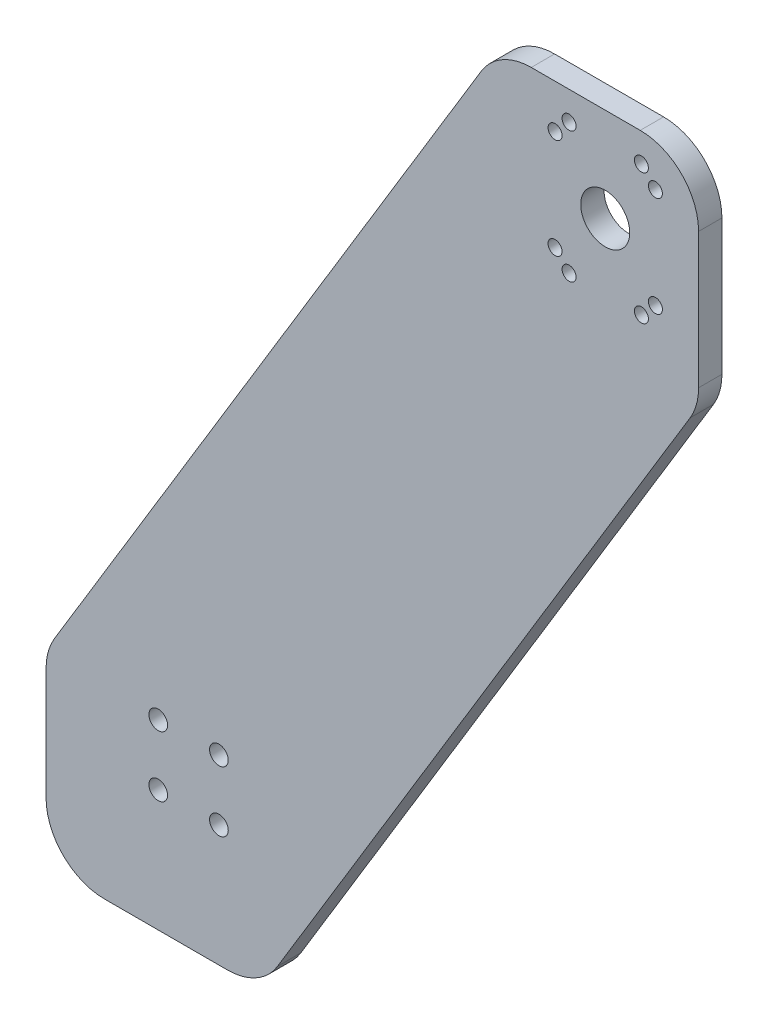
from build123d import *

# Parameters (mm, degrees)
SCHIZZO1_R                   = 4
SCHIZZO1_R_2                 = 10.5
SCHIZZO1_R_3                 = 3
ESTRUSIONE_ESTRUSIONE2_DEPTH = 10
SCHIZZO2_R                   = 2
TAGLIO_ESTRUSIONE1_DEPTH     = 15


with BuildPart() as part:
    # Schizzo1 → Estrusione-Estrusione2 (new body)
    with BuildSketch(Plane.XY):
        with BuildLine():
            Line((25, 0), (77.754610032, 0))
            ThreePointArc((77.754610032, 0), (90.027203873, 3.219654722), (99.138716536, 12.049324766))
            Line((99.138716536, 12.049324766), (275.968165944, 304.029450185))
            ThreePointArc((275.968165944, 304.029450185), (278.66312361, 310.257129904), (279.58405944, 316.980125419))
            Line((279.58405944, 316.980125419), (279.58405944, 375))
            ThreePointArc((279.58405944, 375), (272.26172897, 392.67766953), (254.58405944, 400))
            Line((254.58405944, 400), (207.885664678, 400))
            ThreePointArc((207.885664678, 400), (195.613070837, 396.780345278), (186.501558174, 387.950675234))
            Line((186.501558174, 387.950675234), (3.615893496, 85.970549815))
            ThreePointArc((3.615893496, 85.970549815), (0.92093583, 79.742870096), (0, 73.019874581))
            Line((0, 73.019874581), (0, 25))
            ThreePointArc((0, 25), (7.32233047, 7.32233047), (25, 0))
        make_face()
        with Locations((48.061231211, 78)):
            Circle(SCHIZZO1_R, mode=Mode.SUBTRACT)
        with Locations((74.061231211, 78)):
            Circle(SCHIZZO1_R, mode=Mode.SUBTRACT)
        with Locations((74.061231211, 52)):
            Circle(SCHIZZO1_R, mode=Mode.SUBTRACT)
        with Locations((48.061231211, 52)):
            Circle(SCHIZZO1_R, mode=Mode.SUBTRACT)
        with Locations((239.58405944, 359.776226195)):
            Circle(SCHIZZO1_R_2, mode=Mode.SUBTRACT)
        with Locations((224.08405944, 387.776226195)):
            Circle(SCHIZZO1_R_3, mode=Mode.SUBTRACT)
        with Locations((255.08405944, 387.776226195)):
            Circle(SCHIZZO1_R_3, mode=Mode.SUBTRACT)
        with Locations((261.087176656, 381.279343411)):
            Circle(SCHIZZO1_R_3, mode=Mode.SUBTRACT)
        with Locations((261.087176656, 338.273108979)):
            Circle(SCHIZZO1_R_3, mode=Mode.SUBTRACT)
        with Locations((255.08405944, 331.776226195)):
            Circle(SCHIZZO1_R_3, mode=Mode.SUBTRACT)
        with Locations((224.08405944, 331.776226195)):
            Circle(SCHIZZO1_R_3, mode=Mode.SUBTRACT)
        with Locations((218.080942224, 338.273108979)):
            Circle(SCHIZZO1_R_3, mode=Mode.SUBTRACT)
        with Locations((218.080942224, 381.279343411)):
            Circle(SCHIZZO1_R_3, mode=Mode.SUBTRACT)
    extrude(amount=-ESTRUSIONE_ESTRUSIONE2_DEPTH)

    # Schizzo2 → Taglio-Estrusione1 (cut)
    with BuildSketch(Plane.XZ):
        with Locations((51.377305016, -5)):
            Circle(SCHIZZO2_R)
        with Locations((78.877305016, -5)):
            Circle(SCHIZZO2_R)
        with Locations((23.877305016, -5)):
            Circle(SCHIZZO2_R)
    extrude(amount=-TAGLIO_ESTRUSIONE1_DEPTH, mode=Mode.SUBTRACT)


solid = part.part
